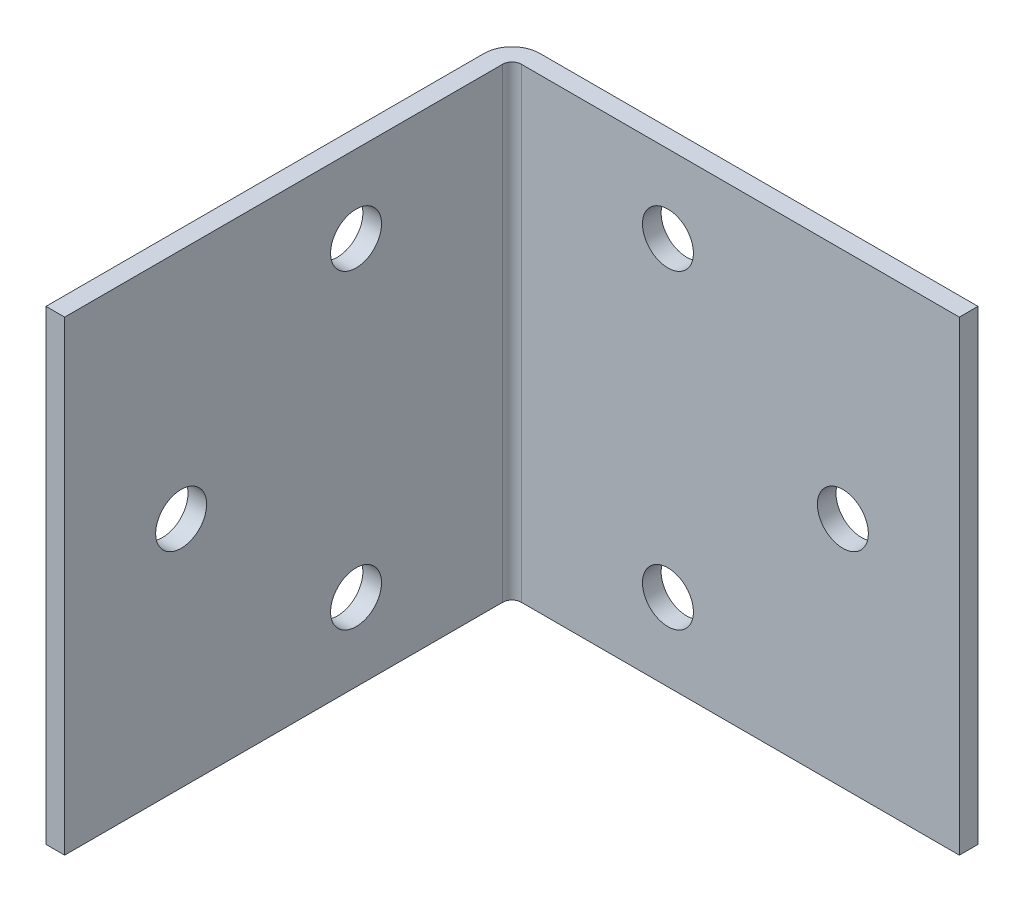
from build123d import *

# Parameters (mm, degrees)
EXTRUDE_THIN1_START = -19.05
EXTRUDE_THIN1_DEPTH = 38.1
SKETCH4_R           = 2.0828
EXTRUDE3_DEPTH      = 57.145492036


# Read off the part's stored shape, not the designer's step: Extrude-Thin1
with BuildPart() as part:
    # Extrude-Thin1 outline → Extrude-Thin1 (new body)
    with BuildSketch(Plane(origin=(0, 0, 0), x_dir=(1, 0, 0), z_dir=(0, 1, 0)).offset(EXTRUDE_THIN1_START)):
        with BuildLine():
            Line((2.286, -1.524), (38.1, -1.524))
            Line((38.1, -1.524), (38.1, 0))
            Line((38.1, 0), (2.286, 0))
            ThreePointArc((2.286, 0), (0.669553898, -0.669553898), (0, -2.286))
            Line((0, -2.286), (0, -38.1))
            Line((0, -38.1), (1.524, -38.1))
            Line((1.524, -38.1), (1.524, -2.286))
            ThreePointArc((1.524, -2.286), (1.747184633, -1.747184633), (2.286, -1.524))
        make_face()
    extrude(amount=EXTRUDE_THIN1_DEPTH)

    # Sketch4 → Extrude3 (cut, through all)
    with BuildSketch(Plane(origin=(1.524, 0, 0), x_dir=(0, 0, -1), z_dir=(1, 0, 0))):
        with Locations((-28.575, 0)):
            Circle(SKETCH4_R)
        with Locations((-14.2748, 12.7)):
            Circle(SKETCH4_R)
        with Locations((-14.2748, -12.7)):
            Circle(SKETCH4_R)
    extrude3 = extrude(amount=-EXTRUDE3_DEPTH, mode=Mode.SUBTRACT)

    # Mirror1: Extrude3 across plane
    add(extrude3.mirror(Plane(origin=(0, 0, 0), x_dir=(0.7071067811865465, 0, 0.7071067811865486), z_dir=(-0.7071067811865488, 0, 0.7071067811865464))), mode=Mode.SUBTRACT)


solid = part.part
